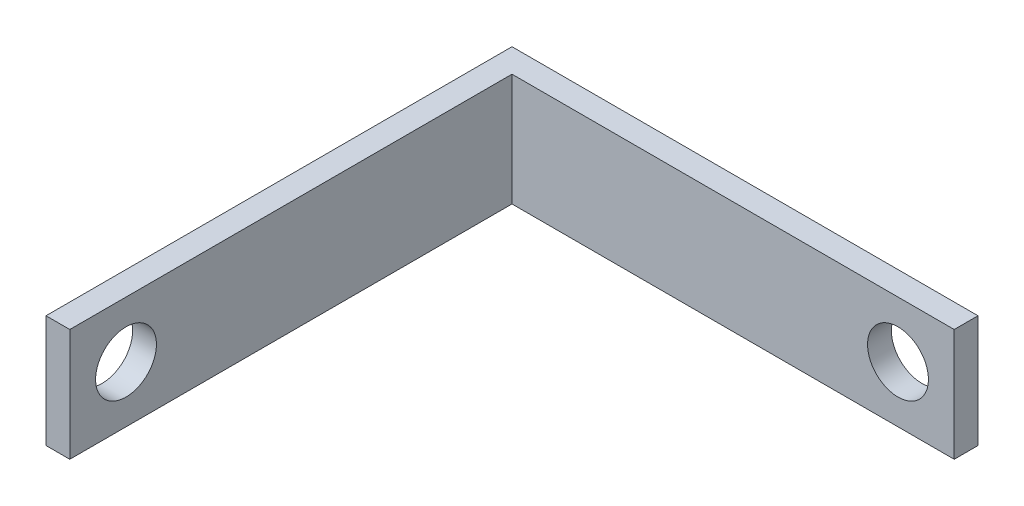
from build123d import *

# Parameters (mm, degrees)
BOSS_EXTRUDE1_DEPTH = 3.75
SKETCH2_R           = 2.03
CUT_EXTRUDE1_DEPTH  = 41.393705032
SKETCH3_R           = 2.03
CUT_EXTRUDE2_DEPTH  = 41.393705032


with BuildPart() as part:
    # Sketch1 → Boss-Extrude1 (new, symmetric)
    with BuildSketch(Plane(origin=(0, 0, 0), x_dir=(1, 0, 0), z_dir=(0, 1, 0))):
        Polygon((-25.75, 25.75), (-3.75, 25.75), (3.75, 25.75), (3.75, 27.3375), (-3.75, 27.3375), (-27.3375, 27.3375), (-27.3375, 3.75), (-27.3375, -3.75), (-25.75, -3.75), (-25.75, 3.75), align=None)
    extrude(amount=BOSS_EXTRUDE1_DEPTH, both=True)

    # Sketch2 → Cut-Extrude1 (cut, through all)
    with BuildSketch(Plane(origin=(-25.75, 0, 0), x_dir=(0, 0, -1), z_dir=(1, 0, 0))):
        Circle(SKETCH2_R)
    extrude(amount=-CUT_EXTRUDE1_DEPTH, mode=Mode.SUBTRACT)

    # Sketch3 → Cut-Extrude2 (cut, through all)
    with BuildSketch(Plane.XY.offset(-25.75)):
        Circle(SKETCH3_R)
    extrude(amount=-CUT_EXTRUDE2_DEPTH, mode=Mode.SUBTRACT)


solid = part.part
